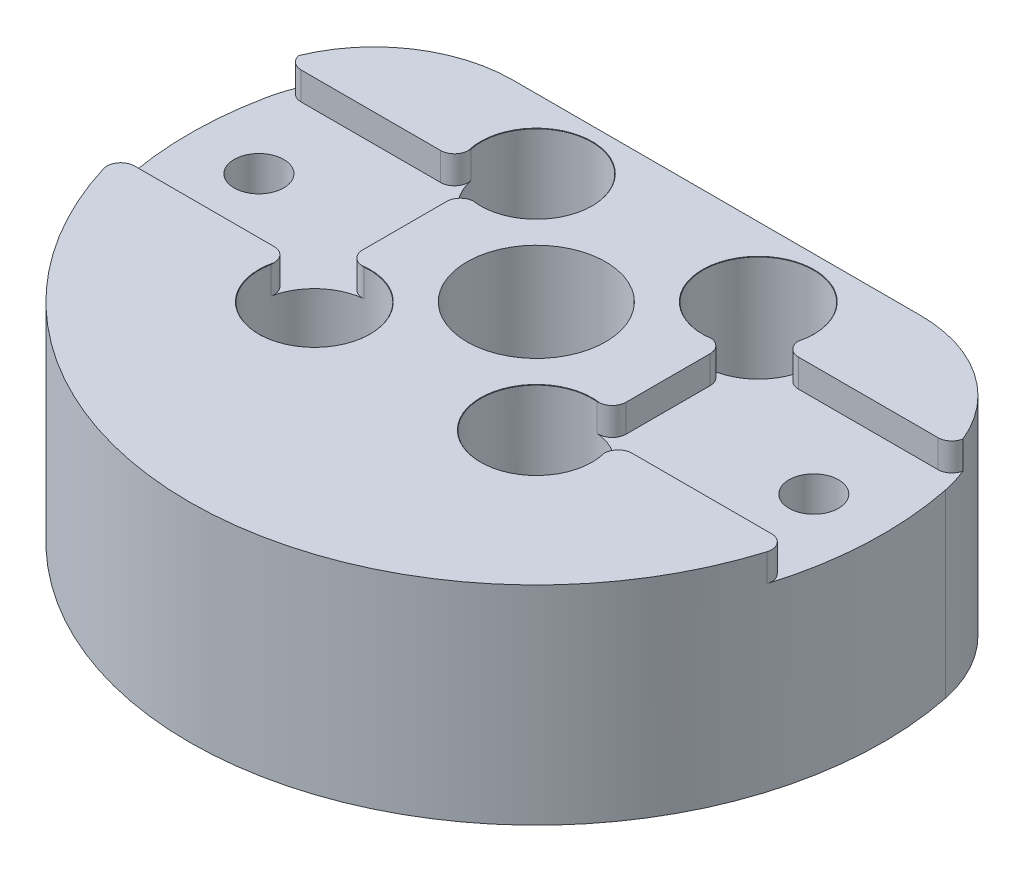
from build123d import *

# Parameters (mm, degrees)
SKETCH1_R                       = 25
BOSS_EXTRUDE1_DEPTH             = 15
CBORE_FOR_M4_SHCS1_AT_2_COUNT   = 2
CBORE_FOR_M4_SHCS1_AT_2_PITCH   = 16
CBORE_FOR_M4_SHCS1_AT_3_COUNT   = 2
CBORE_FOR_M4_SHCS1_AT_3_PITCH   = 22.627416998
CBORE_FOR_M4_SHCS1_AT_4_COUNT   = 2
CBORE_FOR_M4_SHCS1_AT_4_PITCH   = 16
F_10_0MM_DOWEL_HOLE1_D          = 10
F_9_64_0_14063_DIAMETER_HOLE1_D = 3.572002
SKETCH9_W                       = 18
SKETCH9_H                       = 12
CUT_EXTRUDE1_DEPTH              = 2
FILLET2_R                       = 1
CUT_EXTRUDE2_DEPTH              = 39.405728739
FILLET3_START                   = -1
FILLET3_DEPTH                   = 17


with BuildPart() as part:
    # Sketch1 → Boss-Extrude1 (new body)
    with BuildSketch(Plane(origin=(0, 0, 0), x_dir=(1, 0, 0), z_dir=(0, 1, 0))):
        with Locations(Location((0, 0, 0), (0, 0, 270))):
            Circle(SKETCH1_R)
    extrude(amount=BOSS_EXTRUDE1_DEPTH)

    # Sketch4 → CBORE for M4 SHCS1 (revolve, cut)
    with BuildSketch(Plane(origin=(-8, 15, -8), x_dir=(0, 0, 1), z_dir=(1, 0, 0))):
        Polygon((0, 0), (0, 15), (2.25, 15), (2.25, 11), (4, 11), (4, 0.025), (4.025, 0), align=None)
    cbore_for_m4_shcs1 = revolve(axis=Axis((-8, 21.35, -8), (0, -1, 0)), mode=Mode.SUBTRACT)

    # CBORE for M4 SHCS1 at 2: CBORE for M4 SHCS1 ×2
    with Locations(*[(i * CBORE_FOR_M4_SHCS1_AT_2_PITCH, 0, 0) for i in range(1, CBORE_FOR_M4_SHCS1_AT_2_COUNT)]):
        add(cbore_for_m4_shcs1, mode=Mode.SUBTRACT)

    # CBORE for M4 SHCS1 at 3: CBORE for M4 SHCS1 ×2
    with Locations(*[Vector(0.7071067811865476, 0, 0.7071067811865476) * (i * CBORE_FOR_M4_SHCS1_AT_3_PITCH) for i in range(1, CBORE_FOR_M4_SHCS1_AT_3_COUNT)]):
        add(cbore_for_m4_shcs1, mode=Mode.SUBTRACT)

    # CBORE for M4 SHCS1 at 4: CBORE for M4 SHCS1 ×2
    with Locations(*[(0, 0, i * CBORE_FOR_M4_SHCS1_AT_4_PITCH) for i in range(1, CBORE_FOR_M4_SHCS1_AT_4_COUNT)]):
        add(cbore_for_m4_shcs1, mode=Mode.SUBTRACT)

    # Ø10.0mm Dowel Hole1 (through all)
    with Locations(Plane(origin=(0, 15, 0), x_dir=(1, 0, 0), z_dir=(0, 1, 0))):
        with Locations((0, 0)):
            Hole(F_10_0MM_DOWEL_HOLE1_D / 2)

    # 9/64 (0.14063) Diameter Hole1 (through all)
    with Locations(Plane(origin=(0, 15, 0), x_dir=(1, 0, 0), z_dir=(0, 1, 0))):
        with Locations((-20, 0), (20, 0)):
            Hole(F_9_64_0_14063_DIAMETER_HOLE1_D / 2)

    # Sketch9 → Cut-Extrude1 (cut)
    with BuildSketch(Plane(origin=(0, 15, 0), x_dir=(1, 0, 0), z_dir=(0, 1, 0))):
        with Locations((-18.5, 0)):
            Rectangle(SKETCH9_W, SKETCH9_H)
    cut_extrude1 = extrude(amount=-CUT_EXTRUDE1_DEPTH, mode=Mode.SUBTRACT)

    # Mirror1: Cut-Extrude1 across plane
    add(cut_extrude1.mirror(Plane(origin=(0, 0, 0), x_dir=(0, 0, 1), z_dir=(1, 0, 0))), mode=Mode.SUBTRACT)

    # Fillet2
    fillet2_edges = [part.edges().sort_by_distance(p)[0] for p in [
        (-24.269322199, 14, -6),
        (-24.269322199, 14, 6),
        (-11.464101615, 13.9875, 6),
        (-9.5, 13.9875, 4.291900756),
        (-11.464101615, 13.9875, -6),
        (-9.5, 13.9875, -4.291900756),
        (24.269322199, 14, 6),
        (9.5, 13.9875, 4.291900756),
        (9.5, 13.9875, -4.291900756),
        (24.269322199, 14, -6),
        (11.464101615, 13.9875, -6),
        (11.464101615, 13.9875, 6),
    ]]
    fillet(fillet2_edges, radius=FILLET2_R)

    # Sketch10 → Cut-Extrude2 (cut, through all)
    with BuildSketch(Plane(origin=(0, 15, 0), x_dir=(1, 0, 0), z_dir=(0, 1, 0))):
        with BuildLine():
            ThreePointArc((21.354156504, 13), (0, 25), (-21.354156504, 13))
            Line((-21.354156504, 13), (21.354156504, 13))
        make_face()
    extrude(amount=-CUT_EXTRUDE2_DEPTH, mode=Mode.SUBTRACT)

    # Fillet3: read off the stored shape, not the designer's step
    # Fillet3 outline → Fillet3 (cut)
    with BuildSketch(Plane(origin=(0, 0, 0), x_dir=(1, 0, 0), z_dir=(0, 1, 0)).offset(FILLET3_START)):
        with BuildLine():
            Line((21.354156504, 13), (14.696938457, 13))
            ThreePointArc((14.696938457, 13), (21.021493777, 10.745966692), (24.494897428, 5))
            ThreePointArc((24.494897428, 5), (23.270881733, 9.135976324), (21.354156504, 13))
        make_face()
        with BuildLine():
            Line((-14.696938457, 13), (-21.354156504, 13))
            ThreePointArc((-21.354156504, 13), (-23.270881733, 9.135976324), (-24.494897428, 5))
            ThreePointArc((-24.494897428, 5), (-21.021493777, 10.745966692), (-14.696938457, 13))
        make_face()
    extrude(amount=FILLET3_DEPTH, mode=Mode.SUBTRACT)


solid = part.part
